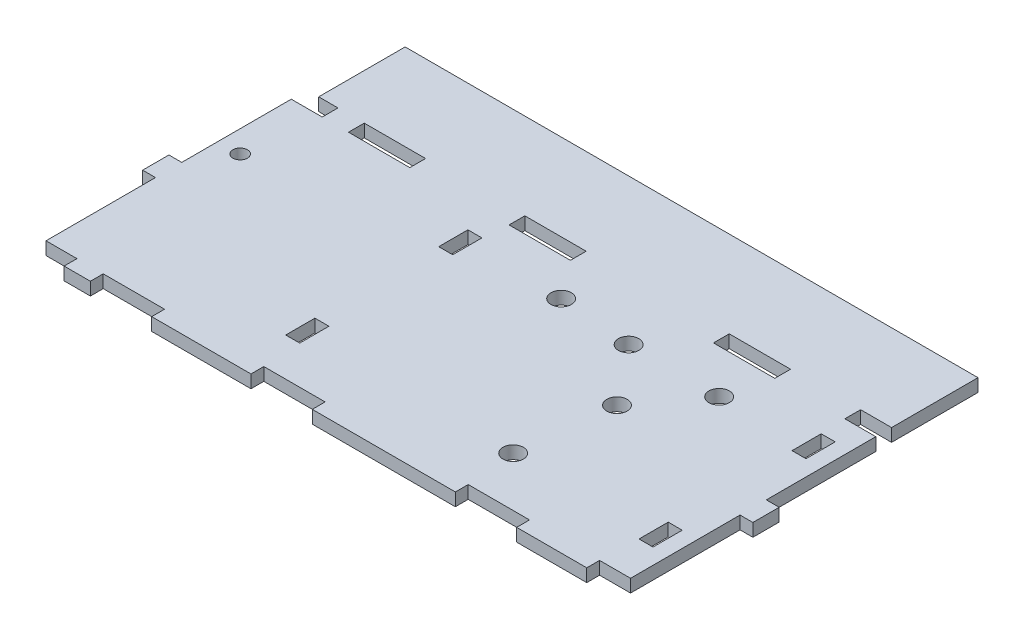
from build123d import *

# Parameters (mm, degrees)
SKETCH1_W           = 26.67
SKETCH1_H           = 6.858
BOSS_EXTRUDE1_DEPTH = 5.588
CUT_EXTRUDE1_REACH  = 184.177
SKETCH9_W           = 6.096
SKETCH9_H           = 12.7
CUT_EXTRUDE2_REACH  = 184.177
SKETCH12_R          = 3.175
CUT_EXTRUDE3_REACH  = 184.177
SKETCH13_R          = 4.445


with BuildPart() as part:
    # Sketch1 → Boss-Extrude1 (new body)
    with BuildSketch(Plane(origin=(0, 0, 0), x_dir=(1, 0, 0), z_dir=(0, 1, 0))):
        Polygon((-110.690062624, 12.380140685), (-116.278062624, 12.380140685), (-116.278062624, 0.950140685), (-110.690062624, 0.950140685), (-110.690062624, -46.674859251), (-97.228062624, -46.674859251), (-97.228062624, -52.262859251), (-85.798062624, -52.262859251), (-85.798062624, -46.674859251), (-59.128062624, -46.674859251), (-59.128062624, -52.262859251), (-15.948062624, -52.262859251), (-15.948062624, -46.674859251), (10.721937376, -46.674859251), (10.721937376, -52.262859251), (72.951937376, -52.262859251), (72.951937376, -46.674859251), (99.621937376, -46.674859251), (99.621937376, -52.262859251), (130.101937376, -52.262859251), (130.101937376, -46.67485938), (143.563937376, -46.67485938), (143.563937376, 0.950140682), (149.151937376, 0.950140682), (149.151937376, 12.38014062), (143.563937376, 12.38014062), (143.563937376, 60.00514062), (130.101937376, 60.00514062), (130.101937376, 66.86314062), (143.563937376, 66.86314062), (143.563937376, 104.45514062), (-105.610062624, 104.45514062), (-105.610062624, 66.86314062), (-97.228062624, 66.86314062), (-97.228062624, 60.00514062), (-110.690062624, 60.00514062), align=None)
        with Locations((-72.463062624, 63.43414062)):
            Rectangle(SKETCH1_W, SKETCH1_H, mode=Mode.SUBTRACT)
        with Locations((-2.613062624, 63.43414062)):
            Rectangle(SKETCH1_W, SKETCH1_H, mode=Mode.SUBTRACT)
        with Locations((86.286937376, 63.43414062)):
            Rectangle(SKETCH1_W, SKETCH1_H, mode=Mode.SUBTRACT)
    extrude(amount=BOSS_EXTRUDE1_DEPTH)

    # Sketch9 → Cut-Extrude1 (cut, up to next)
    with BuildSketch(Plane(origin=(0, 5.588, 0), x_dir=(1, 0, 0), z_dir=(0, 1, 0)), mode=Mode.PRIVATE) as cut_extrude1_sk1:
        with Locations((-20.012062624, -23.687859251)):
            Rectangle(SKETCH9_W, SKETCH9_H)
    cut_extrude1_tool1 = extrude(cut_extrude1_sk1.sketch, amount=-CUT_EXTRUDE1_REACH, mode=Mode.PRIVATE) & part.part
    # Sketch9 → Cut-Extrude1 (cut, up to next)
    with BuildSketch(Plane(origin=(0, 5.588, 0), x_dir=(1, 0, 0), z_dir=(0, 1, 0)), mode=Mode.PRIVATE) as cut_extrude1_sk2:
        with Locations((-20.012062624, 42.860140749)):
            Rectangle(SKETCH9_W, SKETCH9_H)
    cut_extrude1_tool2 = extrude(cut_extrude1_sk2.sketch, amount=-CUT_EXTRUDE1_REACH, mode=Mode.PRIVATE) & part.part
    # Sketch9 → Cut-Extrude1 (cut, up to next)
    with BuildSketch(Plane(origin=(0, 5.588, 0), x_dir=(1, 0, 0), z_dir=(0, 1, 0)), mode=Mode.PRIVATE) as cut_extrude1_sk3:
        with Locations((133.657937376, -23.687859251)):
            Rectangle(SKETCH9_W, SKETCH9_H)
    cut_extrude1_tool3 = extrude(cut_extrude1_sk3.sketch, amount=-CUT_EXTRUDE1_REACH, mode=Mode.PRIVATE) & part.part
    # Sketch9 → Cut-Extrude1 (cut, up to next)
    with BuildSketch(Plane(origin=(0, 5.588, 0), x_dir=(1, 0, 0), z_dir=(0, 1, 0)), mode=Mode.PRIVATE) as cut_extrude1_sk4:
        with Locations((133.657937376, 42.860140749)):
            Rectangle(SKETCH9_W, SKETCH9_H)
    cut_extrude1_tool4 = extrude(cut_extrude1_sk4.sketch, amount=-CUT_EXTRUDE1_REACH, mode=Mode.PRIVATE) & part.part
    add(cut_extrude1_tool1.solids().sort_by_distance((-20.012063, 5.588, 23.687859))[0], mode=Mode.SUBTRACT)
    add(cut_extrude1_tool2.solids().sort_by_distance((-20.012063, 5.588, -42.860141))[0], mode=Mode.SUBTRACT)
    add(cut_extrude1_tool3.solids().sort_by_distance((133.657937, 5.588, 23.687859))[0], mode=Mode.SUBTRACT)
    add(cut_extrude1_tool4.solids().sort_by_distance((133.657937, 5.588, -42.860141))[0], mode=Mode.SUBTRACT)

    # Sketch12 → Cut-Extrude2 (cut, up to next)
    with BuildSketch(Plane(origin=(0, 5.588, 0), x_dir=(1, 0, 0), z_dir=(0, 1, 0)), mode=Mode.PRIVATE) as cut_extrude2_sk1:
        with Locations((-101.165062624, 28.25514062)):
            Circle(SKETCH12_R)
    cut_extrude2_tool1 = extrude(cut_extrude2_sk1.sketch, amount=-CUT_EXTRUDE2_REACH, mode=Mode.PRIVATE) & part.part
    add(cut_extrude2_tool1.solids().sort_by_distance((-101.165063, 5.588, -28.255141))[0], mode=Mode.SUBTRACT)

    # Sketch13 → Cut-Extrude3 (cut, up to next)
    with BuildSketch(Plane.XZ, mode=Mode.PRIVATE) as cut_extrude3_sk1:
        with Locations((70.923937376, 25.084859251)):
            Circle(SKETCH13_R)
    cut_extrude3_tool1 = extrude(cut_extrude3_sk1.sketch, amount=-CUT_EXTRUDE3_REACH, mode=Mode.PRIVATE) & part.part
    # Sketch13 → Cut-Extrude3 (cut, up to next)
    with BuildSketch(Plane.XZ, mode=Mode.PRIVATE) as cut_extrude3_sk2:
        with Locations((55.099783131, -40.95514062)):
            Circle(SKETCH13_R)
    cut_extrude3_tool2 = extrude(cut_extrude3_sk2.sketch, amount=-CUT_EXTRUDE3_REACH, mode=Mode.PRIVATE) & part.part
    # Sketch13 → Cut-Extrude3 (cut, up to next)
    with BuildSketch(Plane.XZ, mode=Mode.PRIVATE) as cut_extrude3_sk3:
        with Locations((94.474354319, -40.95514062)):
            Circle(SKETCH13_R)
    cut_extrude3_tool3 = extrude(cut_extrude3_sk3.sketch, amount=-CUT_EXTRUDE3_REACH, mode=Mode.PRIVATE) & part.part
    # Sketch13 → Cut-Extrude3 (cut, up to next)
    with BuildSketch(Plane.XZ, mode=Mode.PRIVATE) as cut_extrude3_sk4:
        with Locations((75.424354319, -15.55514062)):
            Circle(SKETCH13_R)
    cut_extrude3_tool4 = extrude(cut_extrude3_sk4.sketch, amount=-CUT_EXTRUDE3_REACH, mode=Mode.PRIVATE) & part.part
    # Sketch13 → Cut-Extrude3 (cut, up to next)
    with BuildSketch(Plane.XZ, mode=Mode.PRIVATE) as cut_extrude3_sk5:
        with Locations((23.128937376, -43.580787821)):
            Circle(SKETCH13_R)
    cut_extrude3_tool5 = extrude(cut_extrude3_sk5.sketch, amount=-CUT_EXTRUDE3_REACH, mode=Mode.PRIVATE) & part.part
    add(cut_extrude3_tool1.solids().sort_by_distance((70.923937, 0, 25.084859))[0], mode=Mode.SUBTRACT)
    add(cut_extrude3_tool2.solids().sort_by_distance((55.099783, 0, -40.955141))[0], mode=Mode.SUBTRACT)
    add(cut_extrude3_tool3.solids().sort_by_distance((94.474354, 0, -40.955141))[0], mode=Mode.SUBTRACT)
    add(cut_extrude3_tool4.solids().sort_by_distance((75.424354, 0, -15.555141))[0], mode=Mode.SUBTRACT)
    add(cut_extrude3_tool5.solids().sort_by_distance((23.128937, 0, -43.580788))[0], mode=Mode.SUBTRACT)


solid = part.part
